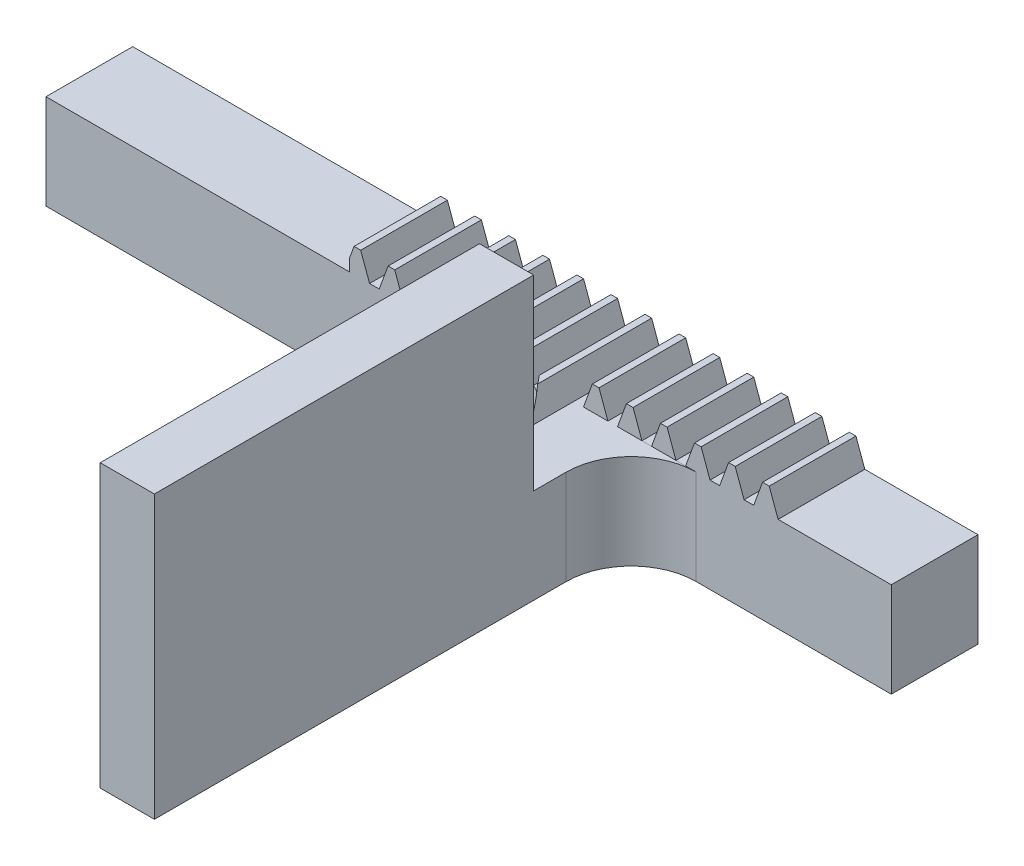
from build123d import *

# Parameters (mm, degrees)
BLANKSKE_W               = 20
BLANKSKE_H               = 5.5
BLANK_DEPTH              = 4
TOOTHCUTSIM_DEPTH        = 22.124630174
TEETHCUTS_COUNT          = 14
TEETHCUTS_PITCH          = 1.570796325
SKETCH1_W                = 2.5
SKETCH1_H                = 13
BOSS_EXTRUDE1_DEPTH      = 22
BOSS_EXTRUDE3_DEPTH      = 5
BOSS_EXTRUDE3_DEPTH_BACK = 34
SKETCH3_W                = 4
SKETCH3_H                = 4.375
CUT_EXTRUDE1_DEPTH       = 38.175260591
CUT_EXTRUDE1_DEPTH_BACK  = 38.175260591
SKETCH4_W                = 4.5
SKETCH4_H                = 8.625
FILLET1_R                = 3


with BuildPart() as part:
    # BlankSke → Blank (new body)
    with BuildSketch(Plane.XY):
        with Locations((10, 2.75)):
            Rectangle(BLANKSKE_W, BLANKSKE_H)
    extrude(amount=-BLANK_DEPTH)

    # TooCutSkeSim → ToothCutSim (cut, through all)
    with BuildSketch(Plane.XY):
        Polygon((0.222217685, 4.375), (-0.222217685, 4.375), (-0.640929042, 5.5254), (0.640929042, 5.5254), align=None)
    toothcutsim = extrude(amount=-TOOTHCUTSIM_DEPTH, mode=Mode.SUBTRACT)

    # TeethCuts: ToothCutSim ×14
    with Locations(*[(i * TEETHCUTS_PITCH, 0, 0) for i in range(1, TEETHCUTS_COUNT)]):
        add(toothcutsim, mode=Mode.SUBTRACT)

    # Sketch1 → Boss-Extrude1 (add)
    with BuildSketch(Plane.XY):
        with Locations((8.25, 6.5)):
            Rectangle(SKETCH1_W, SKETCH1_H)
    extrude(amount=BOSS_EXTRUDE1_DEPTH)

    # Sketch3 → Boss-Extrude3 (add, two sides: drawn at the far end of the back side and taken through both)
    with BuildSketch(Plane.ZY.offset(-BOSS_EXTRUDE3_DEPTH_BACK)):
        with Locations((-2, 2.1875)):
            Rectangle(SKETCH3_W, SKETCH3_H)
    extrude(amount=BOSS_EXTRUDE3_DEPTH + BOSS_EXTRUDE3_DEPTH_BACK)

    # Sketch4 → Cut-Extrude1 (cut, two sides: drawn at the far end of the back side and taken through both)
    with BuildSketch(Plane.ZY.offset(-7).offset(-CUT_EXTRUDE1_DEPTH_BACK)):
        with Locations((2.25, 8.6875)):
            Rectangle(SKETCH4_W, SKETCH4_H)
    extrude(amount=CUT_EXTRUDE1_DEPTH + CUT_EXTRUDE1_DEPTH_BACK, mode=Mode.SUBTRACT)

    # Fillet1
    # the kernel refuses this fillet: 3 mm, written as the material it adds along each edge
    with BuildSketch(Plane(origin=(7, 0, 0), x_dir=(0, 0, 1), z_dir=(0, 1, 0))) as fillet1_piece_1:
        with BuildLine():
            CenterArc((FILLET1_R, -FILLET1_R), FILLET1_R, 90, 90)
            Line((0, -FILLET1_R), (0, 0))
            Line((0, 0), (FILLET1_R, 0))
        make_face()
    extrude(amount=4.375)
    with BuildSketch(Plane(origin=(9.5, 0, 0), x_dir=(0, 0, 1), z_dir=(0, 1, 0))) as fillet1_piece_2:
        with BuildLine():
            CenterArc((FILLET1_R, FILLET1_R), FILLET1_R, 180, 90)
            Line((0, FILLET1_R), (0, 0))
            Line((0, 0), (FILLET1_R, 0))
        make_face()
    extrude(amount=4.375)
    with BuildSketch(Plane(origin=(9.5, -7.5, 0), x_dir=(0, 0, 1), z_dir=(0, 1, 0))) as fillet1_piece_3_section:
        with BuildLine():
            CenterArc((FILLET1_R, FILLET1_R), FILLET1_R, 180, 90)
            Line((0, FILLET1_R), (0, 0))
            Line((0, 0), (FILLET1_R, 0))
        make_face()
    fillet1_piece_3 = extrude(amount=19.375, mode=Mode.PRIVATE)
    fillet1_piece_3 = split(fillet1_piece_3, bisect_by=Plane(origin=(11.636487366, 4.375, 0.067590567), z_dir=(0, 1, 0)), keep=Keep.TOP, mode=Mode.PRIVATE)
    fillet1_piece_3 = split(fillet1_piece_3, bisect_by=Plane(origin=(11.636487366, 5.5, 0.067590567), z_dir=(0, -1, 0)), keep=Keep.TOP, mode=Mode.PRIVATE)
    fillet1_piece_3 = split(fillet1_piece_3, bisect_by=Plane(origin=(11.407964632, 4.897495122, 0.067590567), z_dir=(0.9396926207859105, -0.3420201433256629, 0)), keep=Keep.TOP, mode=Mode.PRIVATE)
    fillet1_piece_3 = split(fillet1_piece_3, bisect_by=Plane(origin=(12.120177158, 4.990368336, 0.067590567), z_dir=(-0.9396926207859105, -0.3420201433256629, 0)), keep=Keep.TOP, mode=Mode.PRIVATE)
    add(fillet1_piece_3)
    with BuildSketch(Plane(origin=(9.5, -7.5, 0), x_dir=(0, 0, 1), z_dir=(0, 1, 0))) as fillet1_piece_4_section:
        with BuildLine():
            CenterArc((FILLET1_R, FILLET1_R), FILLET1_R, 180, 90)
            Line((0, FILLET1_R), (0, 0))
            Line((0, 0), (FILLET1_R, 0))
        make_face()
    fillet1_piece_4 = extrude(amount=19.375, mode=Mode.PRIVATE)
    fillet1_piece_4 = split(fillet1_piece_4, bisect_by=Plane(origin=(10.146205087, 4.375, 0.590480104), z_dir=(0, 1, 0)), keep=Keep.TOP, mode=Mode.PRIVATE)
    fillet1_piece_4 = split(fillet1_piece_4, bisect_by=Plane(origin=(9.84999644, 4.932740127, 0.590480104), z_dir=(0.9396926207859105, -0.3420201433256629, 0)), keep=Keep.TOP, mode=Mode.PRIVATE)
    fillet1_piece_4 = split(fillet1_piece_4, bisect_by=Plane(origin=(10.146205087, 5.5, 0.590480104), z_dir=(0, -1, 0)), keep=Keep.TOP, mode=Mode.PRIVATE)
    fillet1_piece_4 = split(fillet1_piece_4, bisect_by=Plane(origin=(10.555389409, 4.97385991, 0.590480104), z_dir=(-0.9396926207859105, -0.3420201433256629, 0)), keep=Keep.TOP, mode=Mode.PRIVATE)
    add(fillet1_piece_4)


with BuildPart() as body_2:
    # Mirror1: mirrored copy
    add(part.part.mirror(Plane(origin=(34, 0, -4), x_dir=(0, 0, 1), z_dir=(1, 0, 0))))


solid = body_2.part
